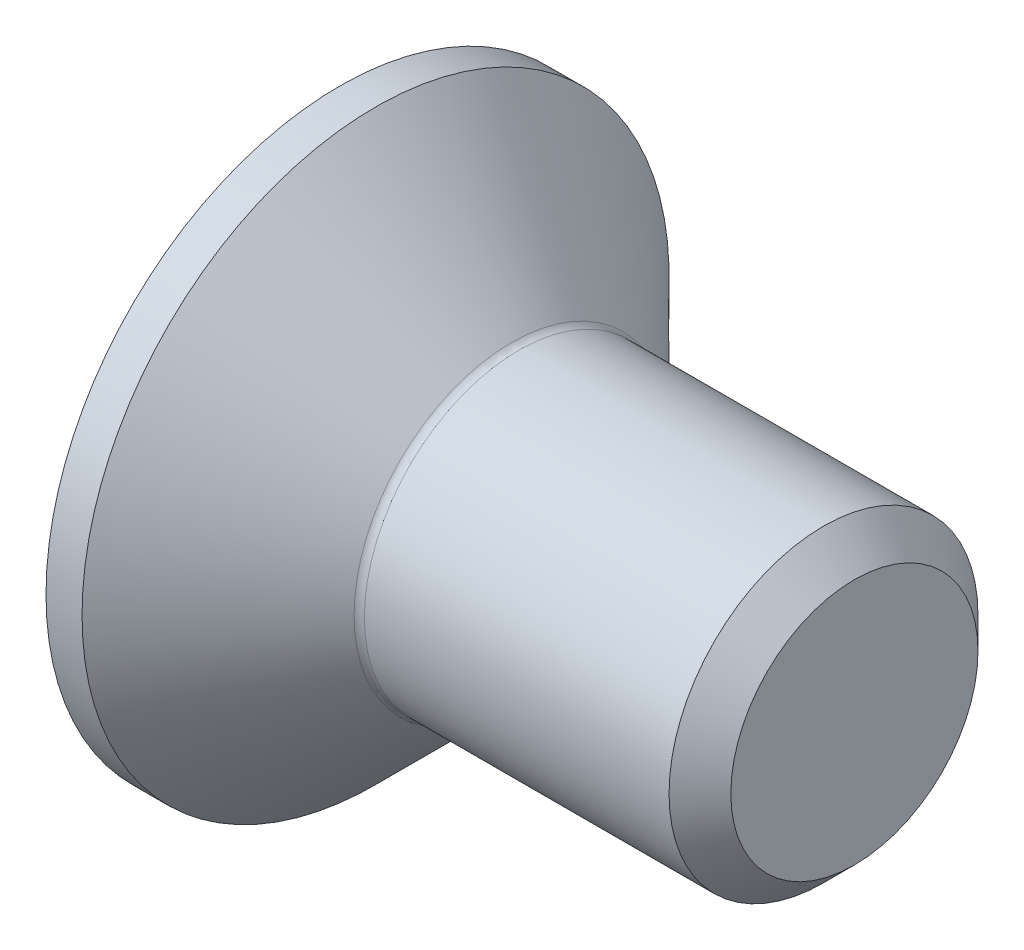
from build123d import *

# Parameters (mm, degrees)
FILLET1_R          = 0.1
HEX_START          = -1.2
HEX_2_DEPTH        = 1.2
SKETCH4_R          = 5.337249995
CUT_EXTRUDE1_DEPTH = 3
CHAMFER1_SIZE      = 0.3


with BuildPart() as part:
    # BodySke → BaseBody (revolve)
    with BuildSketch(Plane.XY, mode=Mode.PRIVATE) as basebody_sk:
        Polygon((0, 0), (0, 2.85), (0.35, 2.85), (1.7, 1.5), (7.7195, 1.5), (8, 1.2195), (8, 0), align=None)
    revolve(basebody_sk.sketch.rotate(Axis((0, 0, 0), (1, 0, 0)), 90), axis=Axis((0, 0, 0), (1, 0, 0)))

    # Fillet1
    fillet1_edges = [part.edges().sort_by_distance(p)[0] for p in [
        (1.7, 0, -1.5),
    ]]
    fillet(fillet1_edges, radius=FILLET1_R)

    # Hex 2: read off the stored shape, not the designer's step
    # Hex 2 outline → Hex 2 (cut)
    with BuildSketch(Plane.ZY.offset(HEX_START)):
        Polygon((-1.01, -0.583123772), (0, -1.166247544), (1.01, -0.583123772), (1.01, 0.583123772), (0, 1.166247544), (-1.01, 0.583123772), align=None)
    extrude(amount=HEX_2_DEPTH, mode=Mode.SUBTRACT)

    # Hex 2 2 outline → Hex 2 2 (revolve, cut)
    with BuildSketch(Plane.YX):
        Polygon((1.01, 1.2), (0, 1.783123772), (0, 1.2), align=None)
    revolve(axis=Axis((0, 0, 0), (1, 0, 0)), mode=Mode.SUBTRACT)

    # Sketch4 → Cut-Extrude1 (cut)
    with BuildSketch(Plane(origin=(8, 0, 0), x_dir=(0, 0, -1), z_dir=(1, 0, 0))):
        Circle(SKETCH4_R)
    extrude(amount=-CUT_EXTRUDE1_DEPTH, mode=Mode.SUBTRACT)

    # Chamfer1
    chamfer1_edges = [part.edges().sort_by_distance(p)[0] for p in [
        (5, 0, -1.5),
    ]]
    chamfer(chamfer1_edges, length=CHAMFER1_SIZE)


solid = part.part
